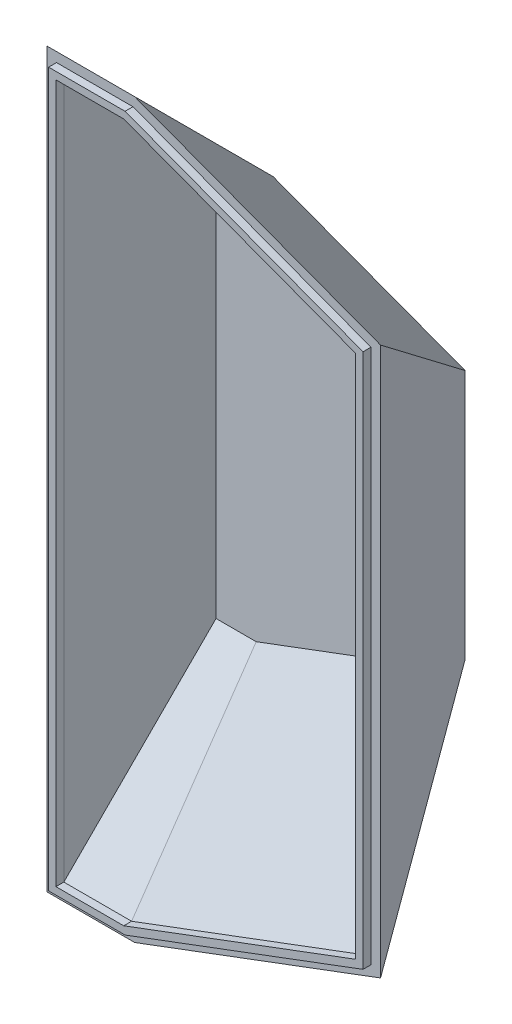
from build123d import *

# Parameters (mm, degrees)
BOSS_EXTRUDE1_DEPTH = 0.889
LOFT2_DEPTH         = 82.529690579
LOFT2_START         = 4.746357977
LOFT2_2_DEPTH       = 59.253642023
LOFT2_START_2       = -13.360997113
LOFT2_3_DEPTH       = 13.360997113
LOFT2_START_3       = -53.387286303
LOFT2_4_DEPTH       = 59.387286303
LOFT2_START_4       = -71.244406959
LOFT2_5_DEPTH       = 13.360997113


with BuildPart() as part:
    # Sketch2 → Boss-Extrude1 (new body)
    with BuildSketch(Plane.XY):
        Polygon((1.079234415, 1.079234415), (1.079234415, 81.450456164), (9.69091533, 81.450456164), (36.503516987, 71.395730542), (36.503516987, 11.133960037), (9.69091533, 1.079234415), align=None)
        Polygon((1.904531321, 1.904531321), (1.904531321, 80.625159258), (9.54126046, 80.625159258), (35.678220081, 70.8237994), (35.678220081, 11.705891179), (9.54126046, 1.904531321), align=None, mode=Mode.SUBTRACT)
    extrude(amount=BOSS_EXTRUDE1_DEPTH)

    # Loft2: read off the stored shape, not the designer's step
    # Loft2 outline → Loft2 (add)
    with BuildSketch(Plane(origin=(0, 0, 0), x_dir=(1, 0, 0), z_dir=(0, 1, 0))):
        Polygon((0, 0), (37.582751402, 0), (28.057751402, 19.05), (0, 19.05), align=None)
    extrude(amount=LOFT2_DEPTH)

    # Loft2 2 outline → Loft2 2 (cut)
    with BuildSketch(Plane(origin=(0, 0, 0), x_dir=(0.9918794395900915, -0.08993102167340751, -0.08993102167340765), z_dir=(0.12718167052860177, 0.7013646778536657, 0.7013646778536667)).offset(LOFT2_START)):
        Polygon((2.384353581, 58.357303857), (30.789607102, 51.013257415), (37, 49.40758916), (37, 73), (-9, 73), (-9, 58.357303857), align=None)
    extrude(amount=LOFT2_2_DEPTH, mode=Mode.SUBTRACT)

    # Loft2 3 outline → Loft2 3 (cut)
    with BuildSketch(Plane(origin=(0, 0, 0), x_dir=(0.9918794395900915, -0.08993102167340751, -0.08993102167340765), z_dir=(0.12718167052860177, 0.7013646778536657, 0.7013646778536667)).offset(LOFT2_START_2)):
        Polygon((37, 49.40758916), (30.789607102, 51.013257415), (2.384353581, 58.357303857), (-9, 58.357303857), (-9, 1), (37, 1), align=None)
    extrude(amount=LOFT2_3_DEPTH, mode=Mode.SUBTRACT)

    # Loft2 4 outline → Loft2 4 (cut)
    with BuildSketch(Plane(origin=(0, 0, 0), x_dir=(0.9918794395900911, 0.08993102167341009, -0.08993102167341009), z_dir=(0.12718167052860532, -0.7013646778536659, 0.7013646778536659)).offset(LOFT2_START_3)):
        Polygon((38.211586494, 7.344046443), (9.806332973, 0), (-1, 0), (-1, -15), (45, -15), (45, 9.099159244), align=None)
    extrude(amount=LOFT2_4_DEPTH, mode=Mode.SUBTRACT)

    # Loft2 5 outline → Loft2 5 (cut)
    with BuildSketch(Plane(origin=(0, 0, 0), x_dir=(0.9918794395900911, 0.08993102167341009, -0.08993102167341009), z_dir=(0.12718167052860532, -0.7013646778536659, 0.7013646778536659)).offset(LOFT2_START_4)):
        Polygon((-1, 0), (9.806332973, 0), (38.211586494, 7.344046443), (45, 9.099159244), (45, 58), (-1, 58), align=None)
    extrude(amount=LOFT2_5_DEPTH, mode=Mode.SUBTRACT)

    # Sketch5 → section 0 of cut_loft2
    with BuildSketch(Plane.XY.offset(-17.145), mode=Mode.PRIVATE) as cut_loft2_s0:
        with BuildLine():
            Line((27.105251402, 26.8023965), (6.432194068, 19.05))
            Line((6.432194068, 19.05), (1.905, 19.05))
            Line((1.905, 19.05), (1.905, 63.479690579))
            Line((1.905, 63.479690579), (6.432194068, 63.479690579))
            Line((6.432194068, 63.479690579), (27.105251402, 55.727294079))
            Line((27.105251402, 55.727294079), (27.105251402, 26.8023965))
        make_face()
    # loft up to a face of the part (cut_loft2)
    loft([cut_loft2_s0.sketch, part.faces().sort_by_distance((17.91973196, 41.264845289, 0))[0]], mode=Mode.SUBTRACT)


solid = part.part
